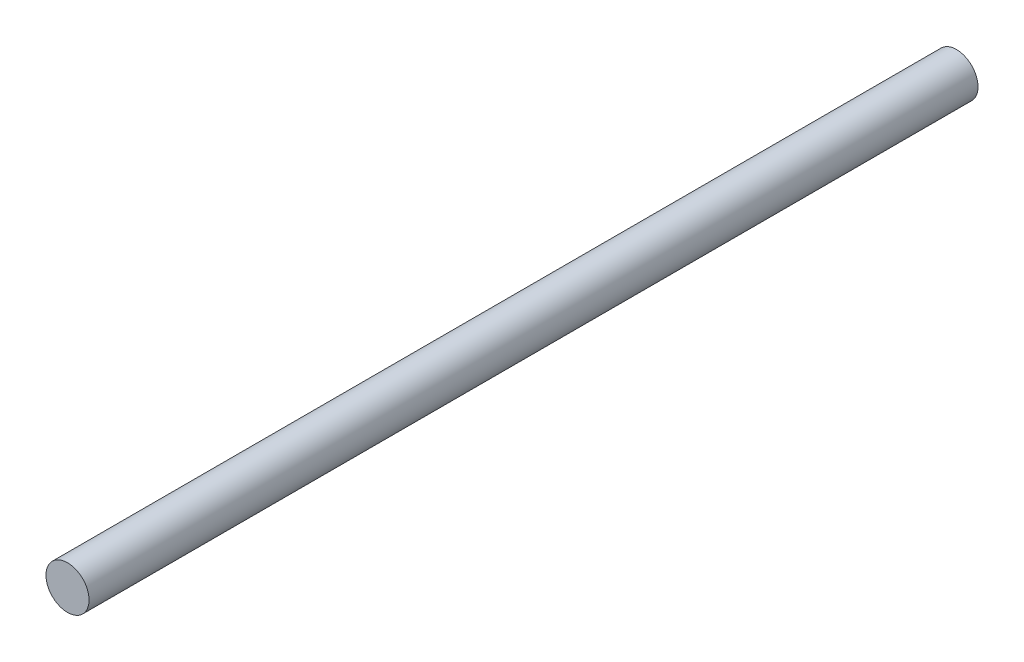
from build123d import *

# Parameters (mm, degrees)
SKETCH1_R           = 4
BOSS_EXTRUDE1_DEPTH = 165


with BuildPart() as part:
    # Sketch1 → Boss-Extrude1 (new body)
    with BuildSketch(Plane.XY):
        Circle(SKETCH1_R)
    extrude(amount=BOSS_EXTRUDE1_DEPTH)


solid = part.part
